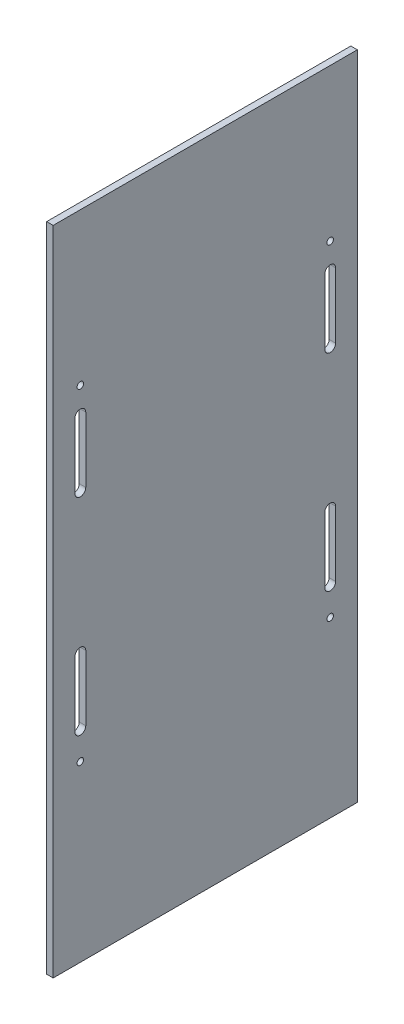
from build123d import *

# Parameters (mm, degrees)
BASE_FLANGE1_OUTLINE_W = 3
BASE_FLANGE1_OUTLINE_H = 140
BASE_FLANGE1_DEPTH     = 300
SKETCH11_R             = 1.5
CUT_EXTRUDE1_DEPTH     = 10
CUT_EXTRUDE2_DEPTH     = 10


# Read off the part's stored shape, not the designer's step: Base-Flange1
with BuildPart() as part:
    # Base-Flange1 outline → Base-Flange1 (new body)
    with BuildSketch(Plane(origin=(0, 0, 0), x_dir=(1, 0, 0), z_dir=(0, 1, 0))):
        with Locations((-1.5, 0)):
            Rectangle(BASE_FLANGE1_OUTLINE_W, BASE_FLANGE1_OUTLINE_H)
    extrude(amount=BASE_FLANGE1_DEPTH)

    # Sketch11 → Cut-Extrude1 (cut)
    with BuildSketch(Plane.ZY.offset(3)):
        with Locations((-57.5, 80)):
            Circle(SKETCH11_R)
        with Locations((57.5, 80)):
            Circle(SKETCH11_R)
        with Locations((-57.5, 230)):
            Circle(SKETCH11_R)
        with Locations((57.5, 230)):
            Circle(SKETCH11_R)
    extrude(amount=-CUT_EXTRUDE1_DEPTH, mode=Mode.SUBTRACT)

    # Sketch12 → Cut-Extrude2 (cut)
    with BuildSketch(Plane.ZY.offset(3)):
        with BuildLine():
            Line((-60, 93.059956427), (-60, 123.059956427))
            ThreePointArc((-60, 123.059956427), (-57.5, 125.559956427), (-55, 123.059956427))
            Line((-55, 123.059956427), (-55, 93.059956427))
            ThreePointArc((-55, 93.059956427), (-57.5, 90.559956427), (-60, 93.059956427))
        make_face()
        with BuildLine():
            Line((-60, 188.059956427), (-60, 218.059956427))
            ThreePointArc((-60, 218.059956427), (-57.5, 220.559956427), (-55, 218.059956427))
            Line((-55, 218.059956427), (-55, 188.059956427))
            ThreePointArc((-55, 188.059956427), (-57.5, 185.559956427), (-60, 188.059956427))
        make_face()
        with BuildLine():
            Line((55, 93.059956427), (55, 123.059956427))
            ThreePointArc((55, 123.059956427), (57.5, 125.559956427), (60, 123.059956427))
            Line((60, 123.059956427), (60, 93.059956427))
            ThreePointArc((60, 93.059956427), (57.5, 90.559956427), (55, 93.059956427))
        make_face()
        with BuildLine():
            Line((60, 218.059956427), (60, 188.059956427))
            ThreePointArc((60, 188.059956427), (57.5, 185.559956427), (55, 188.059956427))
            Line((55, 188.059956427), (55, 218.059956427))
            ThreePointArc((55, 218.059956427), (57.5, 220.559956427), (60, 218.059956427))
        make_face()
    extrude(amount=-CUT_EXTRUDE2_DEPTH, mode=Mode.SUBTRACT)


solid = part.part
